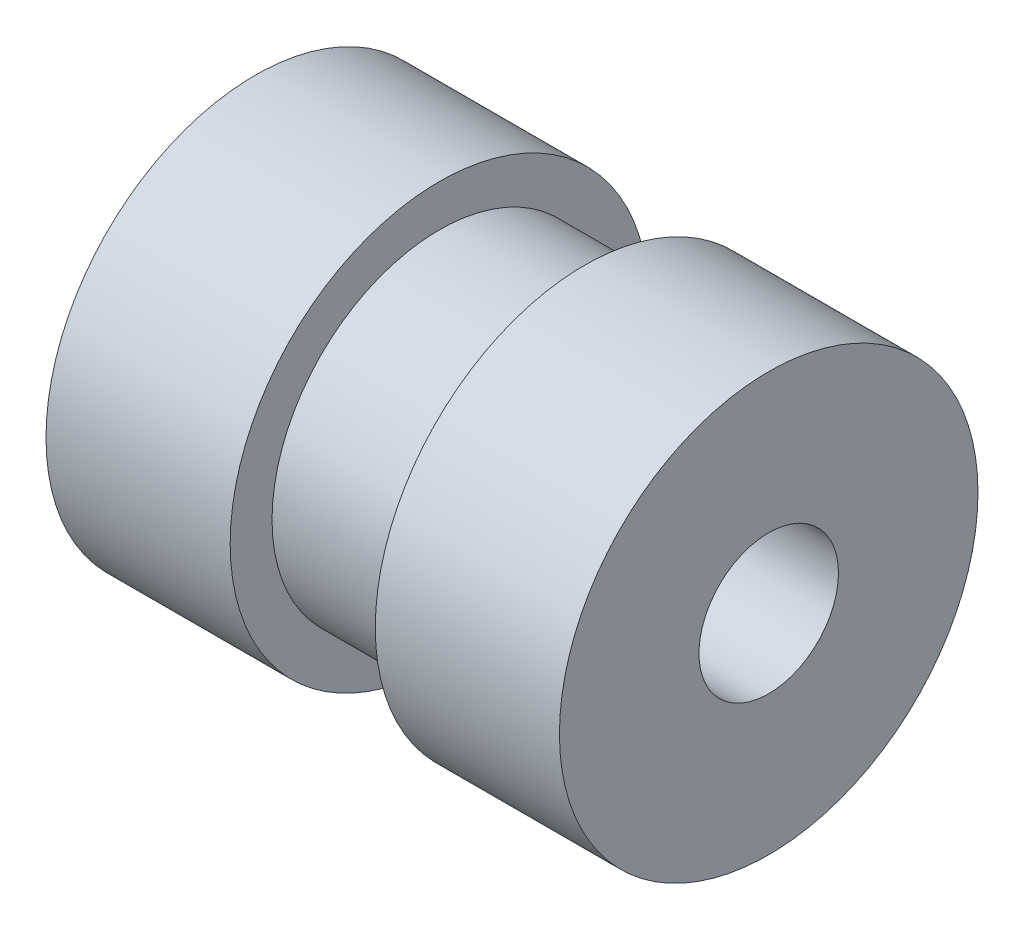
from build123d import *

# Parameters (mm, degrees)
SKETCH1_R           = 9.525
SKETCH1_R_2         = 3.175
BOSS_EXTRUDE1_DEPTH = 8.382
SKETCH2_R           = 7.62
SKETCH2_R_2         = 3.175
BOSS_EXTRUDE2_DEPTH = 6.604
SKETCH3_R           = 9.525
SKETCH3_R_2         = 3.175
BOSS_EXTRUDE3_DEPTH = 8.382


with BuildPart() as part:
    # Sketch1 → Boss-Extrude1 (new body)
    with BuildSketch(Plane(origin=(0, 0, 0), x_dir=(0, 0, -1), z_dir=(1, 0, 0))):
        Circle(SKETCH1_R)
        Circle(SKETCH1_R_2, mode=Mode.SUBTRACT)
    extrude(amount=BOSS_EXTRUDE1_DEPTH)

    # Sketch2 → Boss-Extrude2 (add)
    with BuildSketch(Plane(origin=(8.382, 0, 0), x_dir=(0, 0, -1), z_dir=(1, 0, 0))):
        Circle(SKETCH2_R)
        Circle(SKETCH2_R_2, mode=Mode.SUBTRACT)
    extrude(amount=BOSS_EXTRUDE2_DEPTH)

    # Sketch3 → Boss-Extrude3 (add)
    with BuildSketch(Plane(origin=(14.986, 0, 0), x_dir=(0, 0, -1), z_dir=(1, 0, 0))):
        Circle(SKETCH3_R)
        Circle(SKETCH3_R_2, mode=Mode.SUBTRACT)
    extrude(amount=BOSS_EXTRUDE3_DEPTH)


solid = part.part
